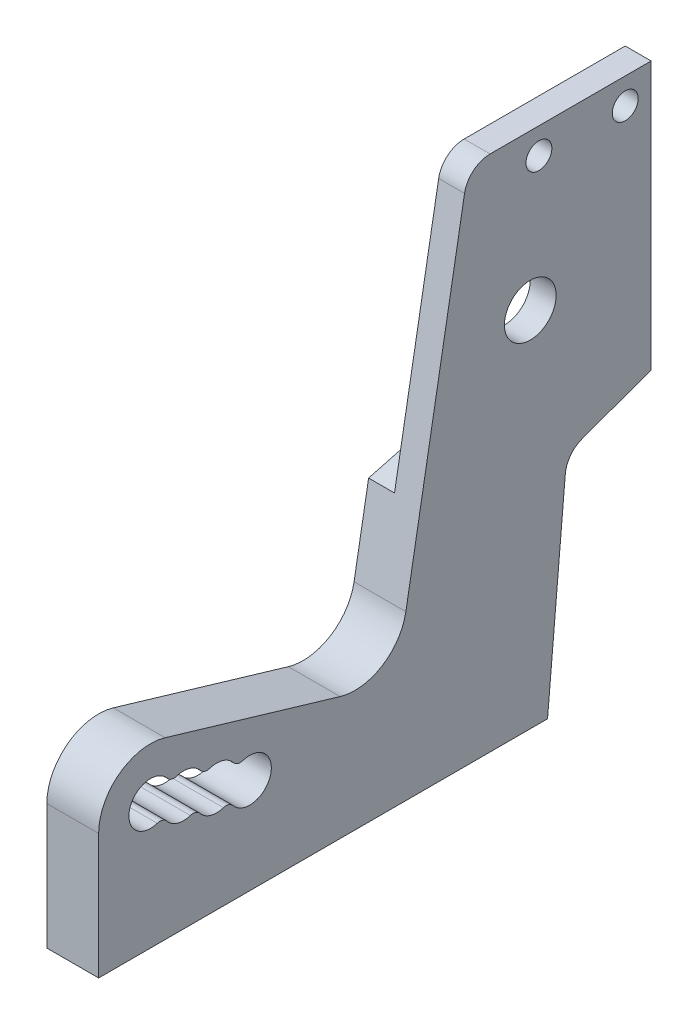
from build123d import *

# Parameters (mm, degrees)
SKETCH1_W                   = 64
SKETCH1_H                   = 60
SKETCH1_R                   = 2.5
SKETCH1_R_2                 = 3
BOSS_EXTRUDE1_DEPTH         = 6
CUT_EXTRUDE1_REACH          = 89.932
CUT_EXTRUDE2_REACH          = 89.932
FILLET1_R                   = 3
FILLET2_R                   = 3
TAP_DRILL_FOR_M3_TAP1_D     = 2.5
TAP_DRILL_FOR_M3_TAP1_DEPTH = 9
TAP_DRILL_FOR_M3_TAP1_TIP   = 0.751075774
CUT_EXTRUDE3_DEPTH          = 3
CUT_EXTRUDE4_REACH          = 89.778
SKETCH10_R                  = 1.5
CUT_EXTRUDE5_REACH          = 89.932
SKETCH11_R                  = 2.5
LPATTERN1_COUNT             = 3
LPATTERN1_PITCH             = 4
FILLET3_R                   = 1


with BuildPart() as part:
    # Sketch1 → Boss-Extrude1 (new body)
    with BuildSketch(Plane(origin=(0, 0, 0), x_dir=(0, 0, -1), z_dir=(1, 0, 0))):
        with Locations((32, 30)):
            Rectangle(SKETCH1_W, SKETCH1_H)
        with Locations((6, 14.5)):
            Circle(SKETCH1_R, mode=Mode.SUBTRACT)
        with Locations((50, 42)):
            Circle(SKETCH1_R_2, mode=Mode.SUBTRACT)
    extrude(amount=BOSS_EXTRUDE1_DEPTH)

    # Sketch2 → Cut-Extrude1 (cut, up to next)
    with BuildSketch(Plane(origin=(6, 0, 0), x_dir=(0, 0, -1), z_dir=(1, 0, 0)), mode=Mode.PRIVATE) as cut_extrude1_sk1:
        with BuildLine():
            Line((7.704518336, 20.252792126), (27.973515784, 14.247207874))
            ThreePointArc((27.973515784, 14.247207874), (32.835128635, 14.897769681), (35.586880638, 18.958110934))
            Line((35.586880638, 18.958110934), (43, 61))
            Line((43, 61), (0, 61))
            Line((0, 61), (0, 14.5))
            ThreePointArc((0, 14.5), (2.41023051, 19.307655874), (7.704518336, 20.252792126))
        make_face()
    cut_extrude1_tool1 = extrude(cut_extrude1_sk1.sketch, amount=-CUT_EXTRUDE1_REACH, mode=Mode.PRIVATE) & part.part
    add(cut_extrude1_tool1.solids().sort_by_distance((6, 39.790313, -20.017305))[0], mode=Mode.SUBTRACT)

    # Sketch3 → Cut-Extrude2 (cut, up to next)
    with BuildSketch(Plane(origin=(6, 0, 0), x_dir=(0, 0, -1), z_dir=(1, 0, 0)), mode=Mode.PRIVATE) as cut_extrude2_sk1:
        Polygon((64, 0), (52, 0), (54.225932994, 25.442530542), (64, 29), align=None)
    cut_extrude2_tool1 = extrude(cut_extrude2_sk1.sketch, amount=-CUT_EXTRUDE2_REACH, mode=Mode.PRIVATE) & part.part
    add(cut_extrude2_tool1.solids().sort_by_distance((6, 13.1347, -58.667711))[0], mode=Mode.SUBTRACT)

    # Fillet1
    fillet1_edges = [part.edges().sort_by_distance(p)[0] for p in [
        (3, 60, -42.823673019),
    ]]
    fillet(fillet1_edges, radius=FILLET1_R)

    # Fillet2
    fillet2_edges = [part.edges().sort_by_distance(p)[0] for p in [
        (3, 25.442530542, -54.225932994),
    ]]
    fillet(fillet2_edges, radius=FILLET2_R)

    # Tap Drill for M3 Tap1
    with Locations(Plane(origin=(0, 0, 0), x_dir=(-1, 0, 0), z_dir=(0, -1, 0))):
        with Locations((-3, 46), (-3, 10)):
            Hole(TAP_DRILL_FOR_M3_TAP1_D / 2, depth=TAP_DRILL_FOR_M3_TAP1_DEPTH)
            with Locations((0, 0, -(TAP_DRILL_FOR_M3_TAP1_DEPTH + TAP_DRILL_FOR_M3_TAP1_TIP / 2))):  # 118° drill point
                Cone(0, TAP_DRILL_FOR_M3_TAP1_D / 2, TAP_DRILL_FOR_M3_TAP1_TIP, mode=Mode.SUBTRACT)

    # Sketch9 → Cut-Extrude3 (cut)
    with BuildSketch(Plane.ZY):
        Polygon((-64, 60), (-64, 33), (-54, 33), (-37.272527114, 28.517887149), (-42.823673019, 60), align=None)
    extrude(amount=-CUT_EXTRUDE3_DEPTH, mode=Mode.SUBTRACT)

    # Sketch10 → Cut-Extrude4 (cut, up to next)
    with BuildSketch(Plane.ZY.offset(-3), mode=Mode.PRIVATE) as cut_extrude4_sk1:
        with Locations((-61, 57)):
            Circle(SKETCH10_R)
    cut_extrude4_tool1 = extrude(cut_extrude4_sk1.sketch, amount=-CUT_EXTRUDE4_REACH, mode=Mode.PRIVATE) & part.part
    # Sketch10 → Cut-Extrude4 (cut, up to next)
    with BuildSketch(Plane.ZY.offset(-3), mode=Mode.PRIVATE) as cut_extrude4_sk2:
        with Locations((-51, 57)):
            Circle(SKETCH10_R)
    cut_extrude4_tool2 = extrude(cut_extrude4_sk2.sketch, amount=-CUT_EXTRUDE4_REACH, mode=Mode.PRIVATE) & part.part
    add(cut_extrude4_tool1.solids().sort_by_distance((3, 57, -61))[0], mode=Mode.SUBTRACT)
    add(cut_extrude4_tool2.solids().sort_by_distance((3, 57, -51))[0], mode=Mode.SUBTRACT)

    # Sketch11 → Cut-Extrude5 (cut, up to next)
    with BuildSketch(Plane.ZY, mode=Mode.PRIVATE) as cut_extrude5_sk1:
        with Locations((-9.835194751, 13.363654443)):
            Circle(SKETCH11_R)
    cut_extrude5_tool1 = extrude(cut_extrude5_sk1.sketch, amount=-CUT_EXTRUDE5_REACH, mode=Mode.PRIVATE) & part.part
    cut_extrude5 = cut_extrude5_tool1.solids().sort_by_distance((0, 13.363654, -9.835195))[0]
    add(cut_extrude5, mode=Mode.SUBTRACT)

    # LPattern1: Cut-Extrude5 ×3
    with Locations(*[Vector(0, -0.28408638926490015, -0.9587986876474288) * (i * LPATTERN1_PITCH) for i in range(1, LPATTERN1_COUNT)]):
        add(cut_extrude5, mode=Mode.SUBTRACT)

    # Fillet3
    fillet3_edges = [part.edges().sort_by_distance(p)[0] for p in [
        (3, 12.49362919, -7.491467791),
        (3, 11.357283633, -11.326662542),
        (3, 10.220938076, -15.161857293),
        (3, 15.370025253, -8.343726959),
        (3, 14.233679696, -12.17892171),
        (3, 13.097334139, -16.01411646),
    ]]
    fillet(fillet3_edges, radius=FILLET3_R)


solid = part.part
